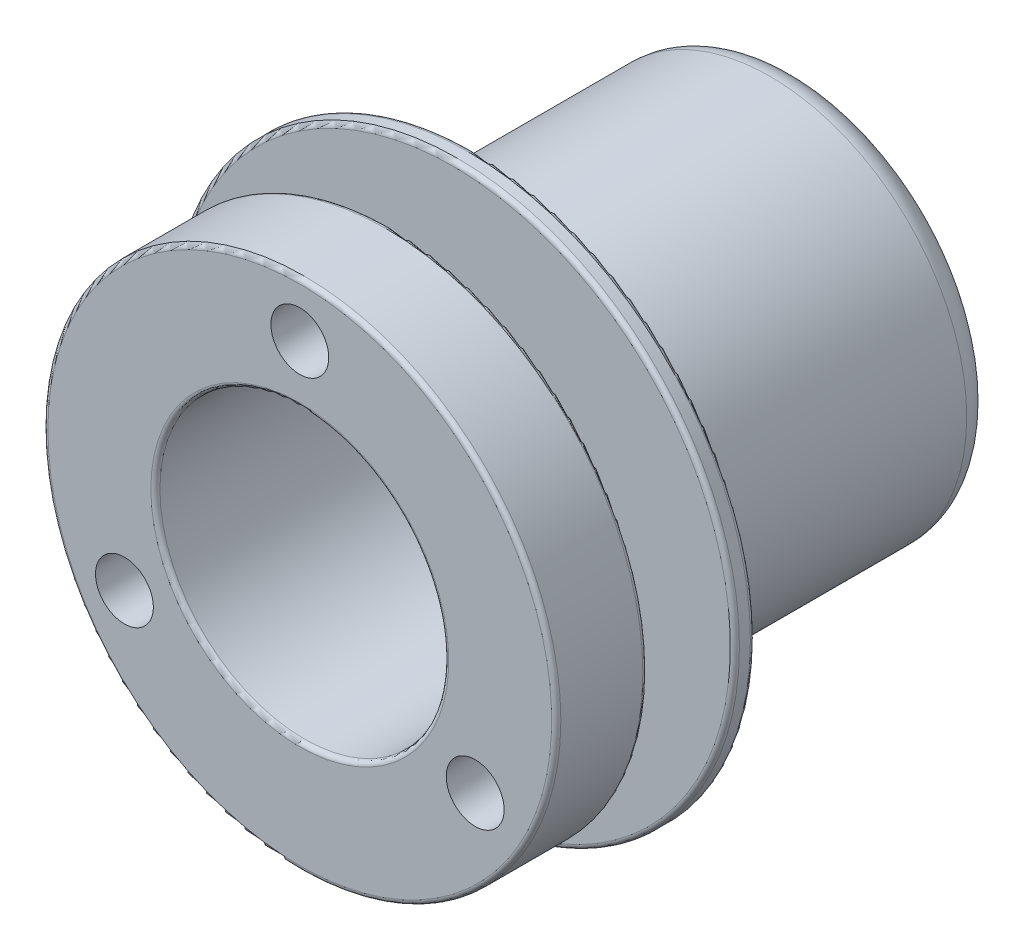
from build123d import *

# Parameters (mm, degrees)
FILLET1_R          = 0.5
CUT_EXTRUDE1_REACH = 71.978
SKETCH2_R          = 3.175


with BuildPart() as part:
    # Sketch1 → Revolve1 (revolve)
    with BuildSketch(Plane(origin=(0, 0, 0), x_dir=(0, 0, -1), z_dir=(1, 0, 0))):
        with BuildLine():
            Line((0, 15.85), (0, 28.15))
            Line((0, 28.15), (10, 28.15))
            Line((10, 28.15), (10, 17.35))
            Line((10, 17.35), (16.804567413, 17.35))
            Line((16.804567413, 17.35), (16.804567413, 30.95))
            Line((16.804567413, 30.95), (19.004567413, 30.95))
            Line((19.004567413, 30.95), (19.004567413, 21.6))
            Line((19.004567413, 21.6), (51.6, 21.6))
            ThreePointArc((51.6, 21.6), (53.721320344, 20.721320344), (54.6, 18.6))
            Line((54.6, 18.6), (54.6, 15.85))
            Line((54.6, 15.85), (0, 15.85))
        make_face()
    revolve(axis=Axis((0, 0, 9.862432658), (0, 0, -1)))

    # Fillet1
    fillet1_edges = [part.edges().sort_by_distance(p)[0] for p in [
        (0, -15.85, 0),
        (0, -28.15, 0),
        (0, -28.15, -10),
        (0, -30.95, -19.004567413),
        (0, -30.95, -16.804567413),
    ]]
    fillet(fillet1_edges, radius=FILLET1_R)

    # Sketch2 → Cut-Extrude1 (cut, up to next)
    with BuildSketch(Plane.XY, mode=Mode.PRIVATE) as cut_extrude1_sk1:
        with Locations((0, 22.225)):
            Circle(SKETCH2_R)
    cut_extrude1_tool1 = extrude(cut_extrude1_sk1.sketch, amount=-CUT_EXTRUDE1_REACH, mode=Mode.PRIVATE) & part.part
    # Sketch2 → Cut-Extrude1 (cut, up to next)
    with BuildSketch(Plane.XY, mode=Mode.PRIVATE) as cut_extrude1_sk2:
        with Locations((19.247414599, -11.1125)):
            Circle(SKETCH2_R)
    cut_extrude1_tool2 = extrude(cut_extrude1_sk2.sketch, amount=-CUT_EXTRUDE1_REACH, mode=Mode.PRIVATE) & part.part
    # Sketch2 → Cut-Extrude1 (cut, up to next)
    with BuildSketch(Plane.XY, mode=Mode.PRIVATE) as cut_extrude1_sk3:
        with Locations((-19.247414599, -11.1125)):
            Circle(SKETCH2_R)
    cut_extrude1_tool3 = extrude(cut_extrude1_sk3.sketch, amount=-CUT_EXTRUDE1_REACH, mode=Mode.PRIVATE) & part.part
    add(cut_extrude1_tool1.solids().sort_by_distance((0, 22.225, 0))[0], mode=Mode.SUBTRACT)
    add(cut_extrude1_tool2.solids().sort_by_distance((19.247415, -11.1125, 0))[0], mode=Mode.SUBTRACT)
    add(cut_extrude1_tool3.solids().sort_by_distance((-19.247415, -11.1125, 0))[0], mode=Mode.SUBTRACT)


solid = part.part
